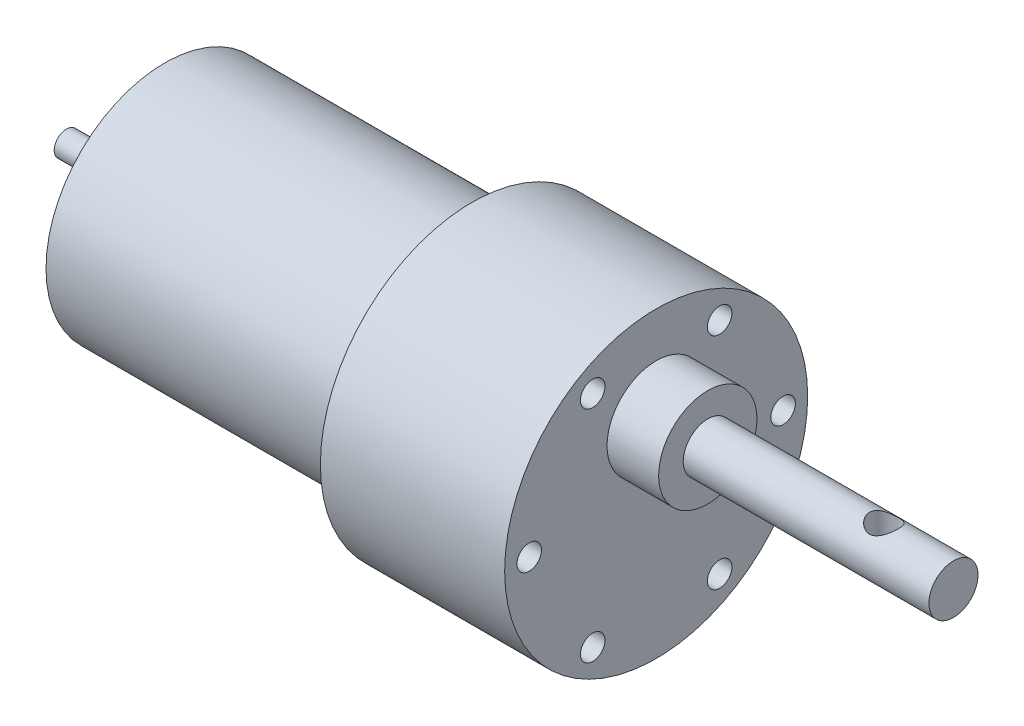
from build123d import *

# Parameters (mm, degrees)
SKETCH3_R          = 1.5
CUT_EXTRUDE1_DEPTH = 3.5
SKETCH4_R          = 1.75
CUT_EXTRUDE2_DEPTH = 104.464679964


with BuildPart() as part:
    # Sketch2 → Revolve2 (revolve)
    with BuildSketch(Plane.XY):
        Polygon((60, 14.5), (60, 33), (37.5, 33), (37.5, 29), (0, 29), (0, 19.5), (-3, 19.5), (-3, 16), (-12, 16), (-12, 14.5), align=None)
    revolve(axis=Axis((-31.266871865, 14.5, 0), (1, 0, 0)))

    # Sketch2<6> → Revolve3 (revolve)
    with BuildSketch(Plane.XY):
        Polygon((60, 27.5), (60, 21.5), (96.3, 21.5), (96.3, 24.5), (66.3, 24.5), (66.3, 27.5), align=None)
    revolve(axis=Axis((60, 21.5, 0), (1, 0, 0)))

    # Sketch3 → Cut-Extrude1 (cut)
    with BuildSketch(Plane(origin=(60, 0, 0), x_dir=(0, 0, -1), z_dir=(1, 0, 0))):
        with Locations((-15.5, 14.5)):
            Circle(SKETCH3_R)
        with Locations((-7.75, 27.923393759)):
            Circle(SKETCH3_R)
        with Locations((7.75, 27.923393759)):
            Circle(SKETCH3_R)
        with Locations((15.5, 14.5)):
            Circle(SKETCH3_R)
        with Locations((7.75, 1.076606241)):
            Circle(SKETCH3_R)
        with Locations((-7.75, 1.076606241)):
            Circle(SKETCH3_R)
    extrude(amount=-CUT_EXTRUDE1_DEPTH, mode=Mode.SUBTRACT)

    # Sketch4 → Cut-Extrude2 (cut, through all)
    with BuildSketch(Plane(origin=(0, 0, 0), x_dir=(1, 0, 0), z_dir=(0, 1, 0))):
        with Locations((87.8, 0)):
            Circle(SKETCH4_R)
    extrude(amount=CUT_EXTRUDE2_DEPTH, mode=Mode.SUBTRACT)


solid = part.part
